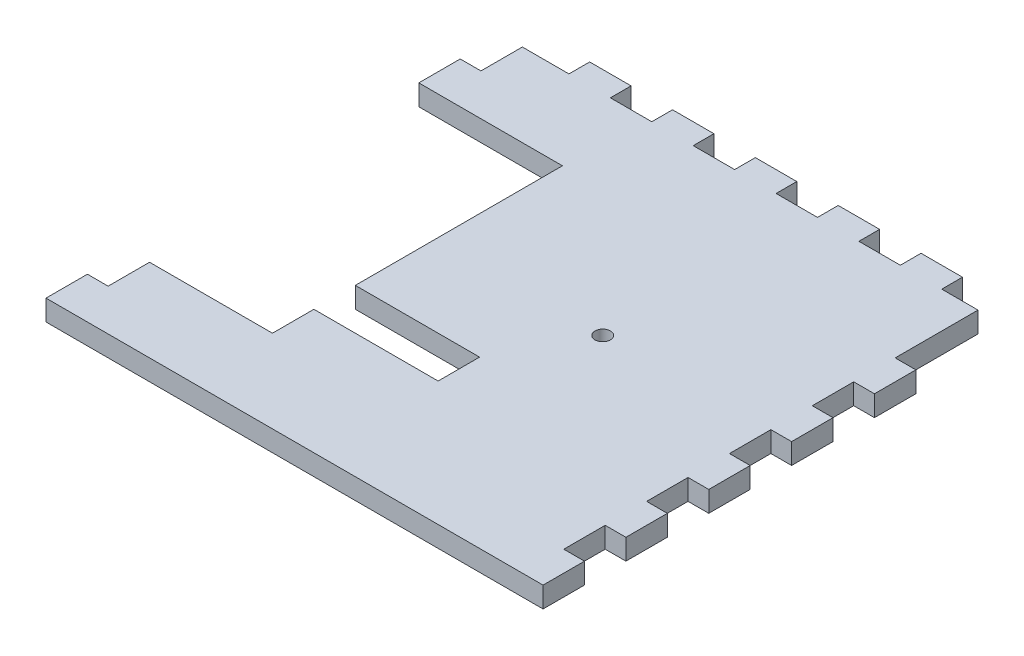
from build123d import *

# Parameters (mm, degrees)
SKETCH1_W               = 279.4
SKETCH1_H               = 279.4
BOSS_EXTRUDE1_DEPTH     = 12.7
SKETCH2_W               = 25.4
SKETCH2_H               = 12.7
BOSS_EXTRUDE2_DEPTH     = 12.7
LPATTERN1_COUNT         = 5
LPATTERN1_PITCH         = 50.8
MIRROR1_COPY_1_SKETCH_W = 25.4
MIRROR1_COPY_1_SKETCH_H = 12.7
MIRROR1_COPY_1_DEPTH    = 12.7
MIRROR1_COPY_2_SKETCH_W = 25.4
MIRROR1_COPY_2_SKETCH_H = 12.7
MIRROR1_COPY_2_DEPTH    = 12.7
MIRROR1_COPY_3_SKETCH_W = 25.4
MIRROR1_COPY_3_SKETCH_H = 12.7
MIRROR1_COPY_3_DEPTH    = 12.7
MIRROR1_COPY_4_SKETCH_W = 25.4
MIRROR1_COPY_4_SKETCH_H = 12.7
MIRROR1_COPY_4_DEPTH    = 12.7
MIRROR1_COPY_5_SKETCH_W = 25.4
MIRROR1_COPY_5_SKETCH_H = 12.7
MIRROR1_COPY_5_DEPTH    = 12.7
SKETCH3_W               = 25.4
SKETCH3_H               = 12.7
BOSS_EXTRUDE3_DEPTH     = 12.7
LPATTERN2_COUNT         = 5
LPATTERN2_PITCH         = 50.8
SKETCH6_R               = 4.7625
CUT_EXTRUDE1_DEPTH      = 216.9
SKETCH8_W               = 88.066093183
SKETCH8_H               = 177.8
CUT_EXTRUDE3_DEPTH      = 216.9
SKETCH9_W               = 25.4
SKETCH9_H               = 12.7
BOSS_EXTRUDE4_DEPTH     = 12.7
SKETCH11_W              = 25.4
SKETCH11_H              = 12.7
CUT_EXTRUDE4_DEPTH      = 76.2


with BuildPart() as part:
    # Sketch1 → Boss-Extrude1 (new body)
    with BuildSketch(Plane(origin=(0, 0, 0), x_dir=(1, 0, 0), z_dir=(0, 1, 0))):
        Rectangle(SKETCH1_W, SKETCH1_H)
    extrude(amount=BOSS_EXTRUDE1_DEPTH)

    # Sketch2 → Boss-Extrude2 (add)
    with BuildSketch(Plane(origin=(139.7, 0, 0), x_dir=(0, 0, -1), z_dir=(1, 0, 0))):
        with Locations((-127, 6.35)):
            Rectangle(SKETCH2_W, SKETCH2_H)
    boss_extrude2 = extrude(amount=BOSS_EXTRUDE2_DEPTH)

    # LPattern1: Boss-Extrude2 ×5
    with Locations(*[(0, 0, -i * LPATTERN1_PITCH) for i in range(1, LPATTERN1_COUNT)]):
        add(boss_extrude2)

    # Mirror1 copy 1 sketch → Mirror1 copy 1 (add)
    with BuildSketch(Plane(origin=(-139.7, 0, -50.8), x_dir=(0, 0, -1), z_dir=(-1, 0, 0))):
        with Locations((-127, -6.35)):
            Rectangle(MIRROR1_COPY_1_SKETCH_W, MIRROR1_COPY_1_SKETCH_H)
    extrude(amount=MIRROR1_COPY_1_DEPTH)

    # Mirror1 copy 2 sketch → Mirror1 copy 2 (add)
    with BuildSketch(Plane(origin=(-139.7, 0, -101.6), x_dir=(0, 0, -1), z_dir=(-1, 0, 0))):
        with Locations((-127, -6.35)):
            Rectangle(MIRROR1_COPY_2_SKETCH_W, MIRROR1_COPY_2_SKETCH_H)
    extrude(amount=MIRROR1_COPY_2_DEPTH)

    # Mirror1 copy 3 sketch → Mirror1 copy 3 (add)
    with BuildSketch(Plane(origin=(-139.7, 0, -152.4), x_dir=(0, 0, -1), z_dir=(-1, 0, 0))):
        with Locations((-127, -6.35)):
            Rectangle(MIRROR1_COPY_3_SKETCH_W, MIRROR1_COPY_3_SKETCH_H)
    extrude(amount=MIRROR1_COPY_3_DEPTH)

    # Mirror1 copy 4 sketch → Mirror1 copy 4 (add)
    with BuildSketch(Plane(origin=(-139.7, 0, -203.2), x_dir=(0, 0, -1), z_dir=(-1, 0, 0))):
        with Locations((-127, -6.35)):
            Rectangle(MIRROR1_COPY_4_SKETCH_W, MIRROR1_COPY_4_SKETCH_H)
    extrude(amount=MIRROR1_COPY_4_DEPTH)

    # Mirror1 copy 5 sketch → Mirror1 copy 5 (add)
    with BuildSketch(Plane(origin=(-139.7, 0, 0), x_dir=(0, 0, -1), z_dir=(-1, 0, 0))):
        with Locations((-127, -6.35)):
            Rectangle(MIRROR1_COPY_5_SKETCH_W, MIRROR1_COPY_5_SKETCH_H)
    extrude(amount=MIRROR1_COPY_5_DEPTH)

    # Sketch3 → Boss-Extrude3 (add)
    with BuildSketch(Plane(origin=(0, 0, -139.7), x_dir=(-1, 0, 0), z_dir=(0, 0, -1))):
        with Locations((-104.775, 6.35)):
            Rectangle(SKETCH3_W, SKETCH3_H)
    boss_extrude3 = extrude(amount=BOSS_EXTRUDE3_DEPTH)

    # LPattern2: Boss-Extrude3 ×5
    with Locations(*[(-i * LPATTERN2_PITCH, 0, 0) for i in range(1, LPATTERN2_COUNT)]):
        add(boss_extrude3)

    # Sketch6 → Cut-Extrude1 (cut, through all)
    with BuildSketch(Plane(origin=(0, 12.7, 0), x_dir=(1, 0, 0), z_dir=(0, 1, 0))):
        with Locations((38.1, 11.176)):
            Circle(SKETCH6_R)
    extrude(amount=-CUT_EXTRUDE1_DEPTH, mode=Mode.SUBTRACT)

    # Sketch8 → Cut-Extrude3 (cut, through all)
    with BuildSketch(Plane(origin=(0, 12.7, 0), x_dir=(1, 0, 0), z_dir=(0, 1, 0))):
        with Locations((-108.366953408, 0)):
            Rectangle(SKETCH8_W, SKETCH8_H)
    extrude(amount=-CUT_EXTRUDE3_DEPTH, mode=Mode.SUBTRACT)

    # Sketch9 → Boss-Extrude4 (add)
    with BuildSketch(Plane.ZY.offset(139.7)):
        with Locations((-101.6, 6.35)):
            Rectangle(SKETCH9_W, SKETCH9_H)
    extrude(amount=BOSS_EXTRUDE4_DEPTH)

    # Sketch11 → Cut-Extrude4 (cut)
    with BuildSketch(Plane.ZY.offset(64.333906817)):
        with Locations((50.8, 6.35)):
            Rectangle(SKETCH11_W, SKETCH11_H)
    extrude(amount=-CUT_EXTRUDE4_DEPTH, mode=Mode.SUBTRACT)


solid = part.part
